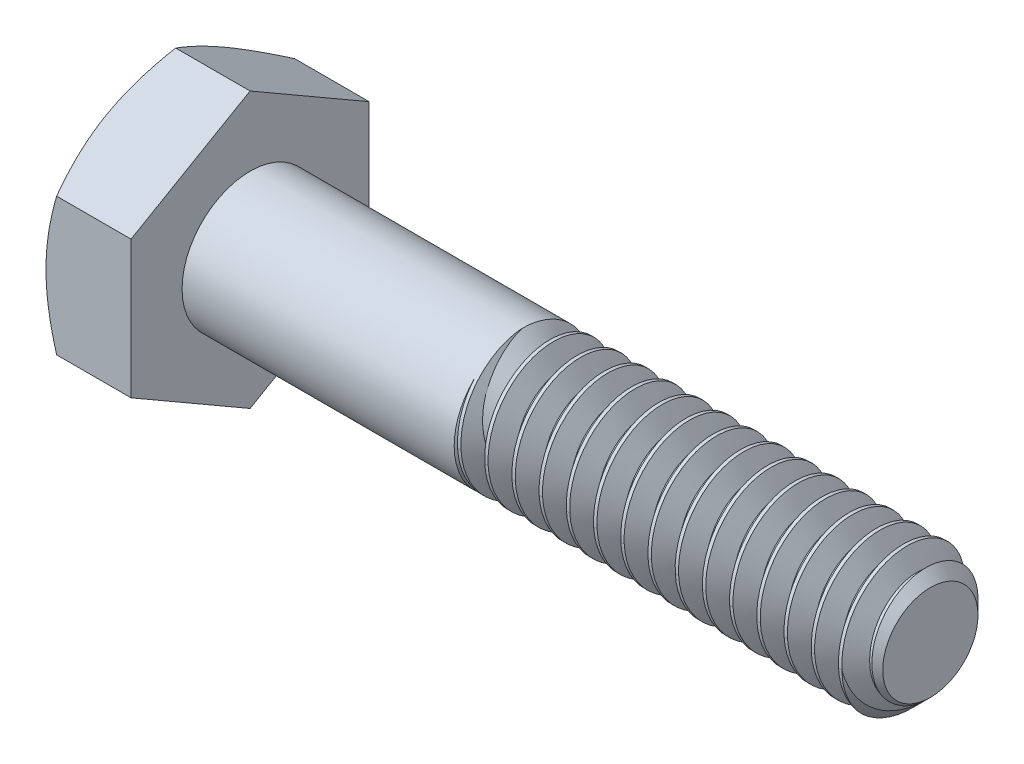
from build123d import *

# Parameters (mm, degrees)
SKETCH5_R           = 3.175
BOSS_EXTRUDE3_DEPTH = 31.75
CHAMFER1_SIZE       = 0.9525
CUT_SWEEP1_PITCH    = 1.27
BOSS_EXTRUDE4_DEPTH = 3.96875
SKETCH8_OUTSIDE_W   = 151.664
SKETCH8_OUTSIDE_H   = 153.384
SKETCH8_OUTSIDE_R   = 5.55625
CUT_EXTRUDE3_DEPTH  = 37.713261567
CUT_EXTRUDE3_DRAFT  = -60


with BuildPart() as part:
    # Sketch5 → Boss-Extrude3 (new body)
    with BuildSketch(Plane(origin=(17.859375, 0, 0), x_dir=(0, 0, -1), z_dir=(1, 0, 0))):
        Circle(SKETCH5_R)
    extrude(amount=-BOSS_EXTRUDE3_DEPTH)

    # Chamfer1
    chamfer1_edges = [part.edges().sort_by_distance(p)[0] for p in [
        (17.859375, 0, 3.175),
    ]]
    chamfer(chamfer1_edges, length=CHAMFER1_SIZE)

    # Cut-Sweep1: the profile of Sketch10 profile screwed along a right-hand helix of 16 turns, 8 arcs to a turn; built about Z, then put on its axis
    cut_sweep1_z = Axis((0, 0, 0), (0, 0, 1))
    cut_sweep1_corners = [(3.1753, 0, 0.000173205), (2.350110803, 0, -0.47625), (2.350110803, 0, -0.635), (3.1753, 0, -1.111423205)]
    with BuildLine(mode=Mode.PRIVATE) as cut_sweep1_profile:
        Line(cut_sweep1_corners[0], cut_sweep1_corners[1])
        Line(cut_sweep1_corners[1], cut_sweep1_corners[2])
        Line(cut_sweep1_corners[2], cut_sweep1_corners[3])
        Line(cut_sweep1_corners[3], cut_sweep1_corners[0])
    cut_sweep1_cap = Face(cut_sweep1_profile.wire())
    cut_sweep1_turn_angles = [0, 22.5, 45, 67.5, 90, 112.5, 135, 157.5, 180, 202.5, 225, 247.5, 270, 292.5, 315, 337.5, 360]
    cut_sweep1_turn_weights = [1, 0.9238795325112867, 1, 0.9238795325112867, 1, 0.9238795325112867, 1, 0.9238795325112867, 1, 0.9238795325112867, 1, 0.9238795325112867, 1, 0.9238795325112867, 1, 0.9238795325112867, 1]
    cut_sweep1_turn_rails = [Edge.make_bspline([Vector(p[0], p[1], 0).rotate(cut_sweep1_z, cut_sweep1_turn_angles[k]) / cut_sweep1_turn_weights[k] + Vector(0, 0, p[2] + CUT_SWEEP1_PITCH * cut_sweep1_turn_angles[k] / 360) for k in range(17)], [0, 0, 0, 1, 1, 2, 2, 3, 3, 4, 4, 5, 5, 6, 6, 7, 7, 8, 8, 8], 2, cut_sweep1_turn_weights) for p in cut_sweep1_corners]
    cut_sweep1_turn_sides = [Face.make_surface_from_curves(cut_sweep1_turn_rails[p[0]], cut_sweep1_turn_rails[p[1]]) for p in [(0, 1), (1, 2), (2, 3), (3, 0)]]
    cut_sweep1 = Plane(origin=(17.859375, 0, 0), x_dir=(0, 1, 0), z_dir=(-1, 0, 0)) * Solid(Shell([*[p.moved(Location((0, 0, CUT_SWEEP1_PITCH * i))) for i in range(16) for p in cut_sweep1_turn_sides], cut_sweep1_cap, cut_sweep1_cap.rotate(cut_sweep1_z, 5760).moved(Location((0, 0, CUT_SWEEP1_PITCH * 5760 / 360)))]))
    add(cut_sweep1, mode=Mode.SUBTRACT)

    # Sketch11 → Revolve1 (revolve)
    with BuildSketch(Plane.XY, mode=Mode.PRIVATE) as revolve1_sk:
        Polygon((-13.890625, 3.175), (-13.890625, 0), (1.984375, 0), (-1.190625, 3.175), align=None)
    revolve(revolve1_sk.sketch.rotate(Axis((-13.890625, 0, 0), (1, 0, 0)), 270), axis=Axis((-13.890625, 0, 0), (1, 0, 0)))

    # Sketch6 → Boss-Extrude4 (add)
    with BuildSketch(Plane.ZY.offset(13.890625)):
        Polygon((5.55625, 3.207902433), (0, 6.415804866), (-5.55625, 3.207902433), (-5.55625, -3.207902433), (0, -6.415804866), (5.55625, -3.207902433), align=None)
    extrude(amount=BOSS_EXTRUDE4_DEPTH)


with BuildPart() as cut_extrude3_tool:
    # Sketch8 outside → Cut-Extrude3 (with draft: the straight prism first)
    with BuildSketch(Plane.ZY.offset(17.859375)):
        Rectangle(SKETCH8_OUTSIDE_W, SKETCH8_OUTSIDE_H)
        Circle(SKETCH8_OUTSIDE_R, mode=Mode.SUBTRACT)
    extrude(amount=-CUT_EXTRUDE3_DEPTH)
    # Cut-Extrude3: the draft: its side faces are tilted about the plane it starts from
    cut_extrude3_sides = [cut_extrude3_tool.faces().sort_by_distance(p)[0] for p in [
        (0.997255783, -76.692, 0),
        (0.997255783, 0, 75.832),
        (0.997255783, 76.692, 0),
        (0.997255783, 0, -75.832),
        (0.997255783, 0, -5.55625),
    ]]
    draft(cut_extrude3_sides, Plane.ZY.offset(17.859375), CUT_EXTRUDE3_DRAFT)


with BuildPart() as part_1:
    add(part.part)

    # Cut-Extrude3: cut by cut_extrude3_tool
    add(cut_extrude3_tool.part, mode=Mode.SUBTRACT)


solid = part_1.part
